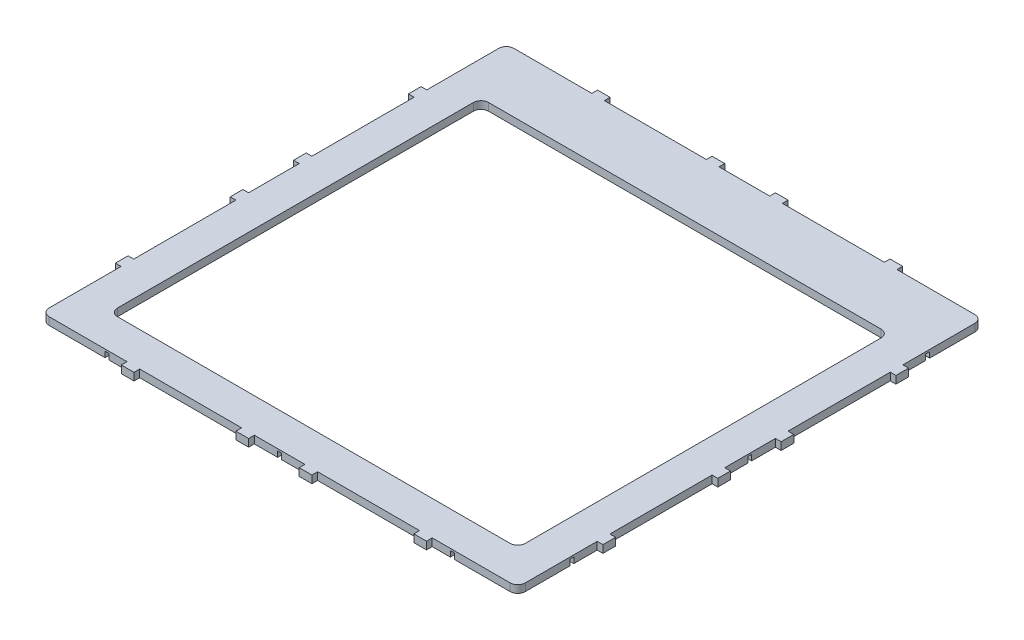
from build123d import *

# Parameters (mm, degrees)
CROQUIS1_R              = 6
SALIENTE_EXTRUIR1_DEPTH = 6
CORTAR_EXTRUIR1_DEPTH   = 4.5
CROQUIS4_W              = 19.689698303
CROQUIS4_H              = 17.939386148
CROQUIS4_W_2            = 19.444542847
SALIENTE_EXTRUIR2_DEPTH = 1.5


with BuildPart() as part:
    # Croquis1 → Saliente-Extruir1 (new body)
    with BuildSketch(Plane(origin=(0, 0, 0), x_dir=(1, 0, 0), z_dir=(0, 1, 0))):
        with BuildLine():
            Line((370, 0), (308.5, 0))
            Line((308.5, 0), (308.5, -4.5))
            Line((308.5, -4.5), (298.5, -4.5))
            Line((298.5, -4.5), (298.5, 0))
            Line((298.5, 0), (218, 0))
            Line((218, 0), (218, -4.5))
            Line((218, -4.5), (208, -4.5))
            Line((208, -4.5), (208, 0))
            Line((208, 0), (168, 0))
            Line((168, 0), (168, -4.5))
            Line((168, -4.5), (158, -4.5))
            Line((158, -4.5), (158, 0))
            Line((158, 0), (77.5, 0))
            Line((77.5, 0), (77.5, -4.5))
            Line((77.5, -4.5), (67.5, -4.5))
            Line((67.5, -4.5), (67.5, 0))
            Line((67.5, 0), (6, 0))
            ThreePointArc((6, 0), (1.757359313, 1.757359313), (0, 6))
            Line((0, 6), (0, 62.8))
            Line((0, 62.8), (-4.5, 62.8))
            Line((-4.5, 62.8), (-4.5, 72.8))
            Line((-4.5, 72.8), (0, 72.8))
            Line((0, 72.8), (0, 153.5))
            Line((0, 153.5), (-4.5, 153.5))
            Line((-4.5, 153.5), (-4.5, 163.5))
            Line((-4.5, 163.5), (0, 163.5))
            Line((0, 163.5), (0, 203.5))
            Line((0, 203.5), (-4.5, 203.5))
            Line((-4.5, 203.5), (-4.5, 213.5))
            Line((-4.5, 213.5), (0, 213.5))
            Line((0, 213.5), (0, 294.2))
            Line((0, 294.2), (-4.5, 294.2))
            Line((-4.5, 294.2), (-4.5, 304.2))
            Line((-4.5, 304.2), (0, 304.2))
            Line((0, 304.2), (0, 361))
            ThreePointArc((0, 361), (1.757359313, 365.242640687), (6, 367))
            Line((6, 367), (67.5, 367))
            Line((67.5, 367), (67.5, 371.5))
            Line((67.5, 371.5), (77.5, 371.5))
            Line((77.5, 371.5), (77.5, 367))
            Line((77.5, 367), (158, 367))
            Line((158, 367), (158, 371.5))
            Line((158, 371.5), (168, 371.5))
            Line((168, 371.5), (168, 367))
            Line((168, 367), (208, 367))
            Line((208, 367), (208, 371.5))
            Line((208, 371.5), (218, 371.5))
            Line((218, 371.5), (218, 367))
            Line((218, 367), (298.5, 367))
            Line((298.5, 367), (298.5, 371.5))
            Line((298.5, 371.5), (308.5, 371.5))
            Line((308.5, 371.5), (308.5, 367))
            Line((308.5, 367), (370, 367))
            ThreePointArc((370, 367), (374.242640687, 365.242640687), (376, 361))
            Line((376, 361), (376, 304.2))
            Line((376, 304.2), (380.5, 304.2))
            Line((380.5, 304.2), (380.5, 294.2))
            Line((380.5, 294.2), (376, 294.2))
            Line((376, 294.2), (376, 213.5))
            Line((376, 213.5), (380.5, 213.5))
            Line((380.5, 213.5), (380.5, 203.5))
            Line((380.5, 203.5), (376, 203.5))
            Line((376, 203.5), (376, 163.5))
            Line((376, 163.5), (380.5, 163.5))
            Line((380.5, 163.5), (380.5, 153.5))
            Line((380.5, 153.5), (376, 153.5))
            Line((376, 153.5), (376, 72.8))
            Line((376, 72.8), (380.5, 72.8))
            Line((380.5, 72.8), (380.5, 62.8))
            Line((380.5, 62.8), (376, 62.8))
            Line((376, 62.8), (376, 6))
            ThreePointArc((376, 6), (374.242640687, 1.757359313), (370, 0))
        make_face()
        with Locations((283, 346)):
            Circle(CROQUIS1_R, mode=Mode.SUBTRACT)
        with Locations((93, 346)):
            Circle(CROQUIS1_R, mode=Mode.SUBTRACT)
        with BuildLine():
            Line((349, 313.979406582), (349, 33))
            ThreePointArc((349, 33), (347.242640687, 28.757359313), (343, 27))
            Line((343, 27), (33, 27))
            ThreePointArc((33, 27), (28.757359313, 28.757359313), (27, 33))
            Line((27, 33), (27, 313.958112531))
            ThreePointArc((27, 313.958112531), (28.769627868, 318.230372132), (33.041887469, 320))
            Line((33.041887469, 320), (342.979406582, 320))
            ThreePointArc((342.979406582, 320), (347.236609015, 318.236609015), (349, 313.979406582))
        make_face(mode=Mode.SUBTRACT)
    extrude(amount=-SALIENTE_EXTRUIR1_DEPTH)

    # Croquis3 → Cortar-Extruir1 (cut)
    with BuildSketch(Plane.XZ.offset(6)):
        with BuildLine():
            Line((322.801879925, 0), (325.901879925, 0))
            Line((325.901879925, 0), (325.901879925, -6.500225243))
            ThreePointArc((325.901879925, -6.500225243), (326.82648456, -7.028314779), (327.192217556, -8.028320611))
            Line((327.192217556, -8.028320611), (327.192217556, -9.578320611))
            ThreePointArc((327.192217556, -9.578320611), (327.004452384, -10.317790877), (326.486648169, -10.878104031))
            Line((326.486648169, -10.878104031), (326.317403237, -10.878104031))
            ThreePointArc((326.317403237, -10.878104031), (324.351879925, -12.24449376), (322.386356613, -10.878104031))
            Line((322.386356613, -10.878104031), (322.217111681, -10.878104031))
            ThreePointArc((322.217111681, -10.878104031), (321.699307467, -10.317790877), (321.511542294, -9.578320611))
            Line((321.511542294, -9.578320611), (321.511542294, -8.028320611))
            ThreePointArc((321.511542294, -8.028320611), (321.87727529, -7.028314779), (322.801879925, -6.500225243))
            Line((322.801879925, -6.500225243), (322.801879925, 0))
        make_face()
        with BuildLine():
            Line((53.784768244, -356.121895969), (53.615523312, -356.121895969))
            ThreePointArc((53.615523312, -356.121895969), (51.65, -354.75550624), (49.684476688, -356.121895969))
            Line((49.684476688, -356.121895969), (49.515231756, -356.121895969))
            ThreePointArc((49.515231756, -356.121895969), (48.997427542, -356.682209123), (48.809662369, -357.421679389))
            Line((48.809662369, -357.421679389), (48.809662369, -358.971679389))
            ThreePointArc((48.809662369, -358.971679389), (49.175395365, -359.971685221), (50.1, -360.499774757))
            Line((50.1, -360.499774757), (50.1, -367))
            Line((50.1, -367), (53.2, -367))
            Line((53.2, -367), (53.2, -360.499774757))
            ThreePointArc((53.2, -360.499774757), (54.124604635, -359.971685221), (54.490337631, -358.971679389))
            Line((54.490337631, -358.971679389), (54.490337631, -357.421679389))
            ThreePointArc((54.490337631, -357.421679389), (54.302572458, -356.682209123), (53.784768244, -356.121895969))
        make_face()
        with BuildLine():
            Line((190.134768244, -356.121895969), (189.965523312, -356.121895969))
            ThreePointArc((189.965523312, -356.121895969), (188, -354.75550624), (186.034476688, -356.121895969))
            Line((186.034476688, -356.121895969), (185.865231756, -356.121895969))
            ThreePointArc((185.865231756, -356.121895969), (185.347427542, -356.682209123), (185.159662369, -357.421679389))
            Line((185.159662369, -357.421679389), (185.159662369, -358.971679389))
            ThreePointArc((185.159662369, -358.971679389), (185.525395365, -359.971685221), (186.45, -360.499774757))
            Line((186.45, -360.499774757), (186.45, -367))
            Line((186.45, -367), (189.55, -367))
            Line((189.55, -367), (189.55, -360.499774757))
            ThreePointArc((189.55, -360.499774757), (190.474604635, -359.971685221), (190.840337631, -358.971679389))
            Line((190.840337631, -358.971679389), (190.840337631, -357.421679389))
            ThreePointArc((190.840337631, -357.421679389), (190.652572458, -356.682209123), (190.134768244, -356.121895969))
        make_face()
        with BuildLine():
            Line((6.500225243, -44.4), (0, -44.4))
            Line((0, -44.4), (0, -41.3))
            Line((0, -41.3), (6.500225243, -41.3))
            ThreePointArc((6.500225243, -41.3), (7.028314779, -40.375395365), (8.028320611, -40.009662369))
            Line((8.028320611, -40.009662369), (9.578320611, -40.009662369))
            ThreePointArc((9.578320611, -40.009662369), (10.317790877, -40.197427542), (10.878104031, -40.715231756))
            Line((10.878104031, -40.715231756), (10.878104031, -40.884476688))
            ThreePointArc((10.878104031, -40.884476688), (12.24449376, -42.85), (10.878104031, -44.815523312))
            Line((10.878104031, -44.815523312), (10.878104031, -44.984768244))
            ThreePointArc((10.878104031, -44.984768244), (10.317790877, -45.502572458), (9.578320611, -45.690337631))
            Line((9.578320611, -45.690337631), (8.028320611, -45.690337631))
            ThreePointArc((8.028320611, -45.690337631), (7.028314779, -45.324604635), (6.500225243, -44.4))
        make_face()
        with BuildLine():
            Line((10.878104031, -185.534768244), (10.878104031, -185.365523312))
            ThreePointArc((10.878104031, -185.365523312), (12.24449376, -183.4), (10.878104031, -181.434476688))
            Line((10.878104031, -181.434476688), (10.878104031, -181.265231756))
            ThreePointArc((10.878104031, -181.265231756), (10.317790877, -180.747427542), (9.578320611, -180.559662369))
            Line((9.578320611, -180.559662369), (8.028320611, -180.559662369))
            ThreePointArc((8.028320611, -180.559662369), (7.028314779, -180.925395365), (6.500225243, -181.85))
            Line((6.500225243, -181.85), (0, -181.85))
            Line((0, -181.85), (0, -184.95))
            Line((0, -184.95), (6.500225243, -184.95))
            ThreePointArc((6.500225243, -184.95), (7.028314779, -185.874604635), (8.028320611, -186.240337631))
            Line((8.028320611, -186.240337631), (9.578320611, -186.240337631))
            ThreePointArc((9.578320611, -186.240337631), (10.317790877, -186.052572458), (10.878104031, -185.534768244))
        make_face()
        with BuildLine():
            Line((10.878104031, -321.750111483), (10.878104031, -321.919356416))
            ThreePointArc((10.878104031, -321.919356416), (12.24449376, -323.884879727), (10.878104031, -325.850403039))
            Line((10.878104031, -325.850403039), (10.878104031, -326.019647971))
            ThreePointArc((10.878104031, -326.019647971), (10.317790877, -326.537452186), (9.578320611, -326.725217358))
            Line((9.578320611, -326.725217358), (8.028320611, -326.725217358))
            ThreePointArc((8.028320611, -326.725217358), (7.028314779, -326.359484362), (6.500225243, -325.434879727))
            Line((6.500225243, -325.434879727), (0, -325.434879727))
            Line((0, -325.434879727), (0, -322.334879727))
            Line((0, -322.334879727), (6.500225243, -322.334879727))
            ThreePointArc((6.500225243, -322.334879727), (7.028314779, -321.410275093), (8.028320611, -321.044542096))
            Line((8.028320611, -321.044542096), (9.578320611, -321.044542096))
            ThreePointArc((9.578320611, -321.044542096), (10.317790877, -321.232307269), (10.878104031, -321.750111483))
        make_face()
        with BuildLine():
            Line((369.499774757, -322.15), (376, -322.15))
            Line((376, -322.15), (376, -325.25))
            Line((376, -325.25), (369.499774757, -325.25))
            ThreePointArc((369.499774757, -325.25), (368.971685221, -326.174604635), (367.971679389, -326.540337631))
            Line((367.971679389, -326.540337631), (366.421679389, -326.540337631))
            ThreePointArc((366.421679389, -326.540337631), (365.682209123, -326.352572458), (365.121895969, -325.834768244))
            Line((365.121895969, -325.834768244), (365.121895969, -325.665523312))
            ThreePointArc((365.121895969, -325.665523312), (363.75550624, -323.7), (365.121895969, -321.734476688))
            Line((365.121895969, -321.734476688), (365.121895969, -321.565231756))
            ThreePointArc((365.121895969, -321.565231756), (365.682209123, -321.047427542), (366.421679389, -320.859662369))
            Line((366.421679389, -320.859662369), (367.971679389, -320.859662369))
            ThreePointArc((367.971679389, -320.859662369), (368.971685221, -321.225395365), (369.499774757, -322.15))
        make_face()
        with BuildLine():
            Line((367.971679389, -180.373855212), (366.421679389, -180.373855212))
            ThreePointArc((366.421679389, -180.373855212), (365.682209123, -180.561620384), (365.121895969, -181.079424598))
            Line((365.121895969, -181.079424598), (365.121895969, -181.248669531))
            ThreePointArc((365.121895969, -181.248669531), (363.75550624, -183.214192843), (365.121895969, -185.179716154))
            Line((365.121895969, -185.179716154), (365.121895969, -185.348961087))
            ThreePointArc((365.121895969, -185.348961087), (365.682209123, -185.866765301), (366.421679389, -186.054530474))
            Line((366.421679389, -186.054530474), (367.971679389, -186.054530474))
            ThreePointArc((367.971679389, -186.054530474), (368.971685221, -185.688797477), (369.499774757, -184.764192843))
            Line((369.499774757, -184.764192843), (376, -184.764192843))
            Line((376, -184.764192843), (376, -181.664192843))
            Line((376, -181.664192843), (369.499774757, -181.664192843))
            ThreePointArc((369.499774757, -181.664192843), (368.971685221, -180.739588208), (367.971679389, -180.373855212))
        make_face()
        with BuildLine():
            Line((365.121895969, -44.862745577), (365.121895969, -44.693500644))
            ThreePointArc((365.121895969, -44.693500644), (363.75550624, -42.727977333), (365.121895969, -40.762454021))
            Line((365.121895969, -40.762454021), (365.121895969, -40.593209088))
            ThreePointArc((365.121895969, -40.593209088), (365.682209123, -40.075404874), (366.421679389, -39.887639702))
            Line((366.421679389, -39.887639702), (367.971679389, -39.887639702))
            ThreePointArc((367.971679389, -39.887639702), (368.971685221, -40.253372698), (369.499774757, -41.177977333))
            Line((369.499774757, -41.177977333), (376, -41.177977333))
            Line((376, -41.177977333), (376, -44.277977333))
            Line((376, -44.277977333), (369.499774757, -44.277977333))
            ThreePointArc((369.499774757, -44.277977333), (368.971685221, -45.202581967), (367.971679389, -45.568314963))
            Line((367.971679389, -45.568314963), (366.421679389, -45.568314963))
            ThreePointArc((366.421679389, -45.568314963), (365.682209123, -45.380549791), (365.121895969, -44.862745577))
        make_face()
        with BuildLine():
            Line((50.1, 0), (53.2, 0))
            Line((53.2, 0), (53.2, -6.500225243))
            ThreePointArc((53.2, -6.500225243), (54.124604635, -7.028314779), (54.490337631, -8.028320611))
            Line((54.490337631, -8.028320611), (54.490337631, -9.578320611))
            ThreePointArc((54.490337631, -9.578320611), (54.302572458, -10.317790877), (53.784768244, -10.878104031))
            Line((53.784768244, -10.878104031), (53.615523312, -10.878104031))
            ThreePointArc((53.615523312, -10.878104031), (51.65, -12.24449376), (49.684476688, -10.878104031))
            Line((49.684476688, -10.878104031), (49.515231756, -10.878104031))
            ThreePointArc((49.515231756, -10.878104031), (48.997427542, -10.317790877), (48.809662369, -9.578320611))
            Line((48.809662369, -9.578320611), (48.809662369, -8.028320611))
            ThreePointArc((48.809662369, -8.028320611), (49.175395365, -7.028314779), (50.1, -6.500225243))
            Line((50.1, -6.500225243), (50.1, 0))
        make_face()
        with BuildLine():
            Line((326.486648169, -356.121895969), (326.317403237, -356.121895969))
            ThreePointArc((326.317403237, -356.121895969), (324.351879925, -354.75550624), (322.386356613, -356.121895969))
            Line((322.386356613, -356.121895969), (322.217111681, -356.121895969))
            ThreePointArc((322.217111681, -356.121895969), (321.699307467, -356.682209123), (321.511542294, -357.421679389))
            Line((321.511542294, -357.421679389), (321.511542294, -358.971679389))
            ThreePointArc((321.511542294, -358.971679389), (321.87727529, -359.971685221), (322.801879925, -360.499774757))
            Line((322.801879925, -360.499774757), (322.801879925, -367))
            Line((322.801879925, -367), (325.901879925, -367))
            Line((325.901879925, -367), (325.901879925, -360.499774757))
            ThreePointArc((325.901879925, -360.499774757), (326.82648456, -359.971685221), (327.192217556, -358.971679389))
            Line((327.192217556, -358.971679389), (327.192217556, -357.421679389))
            ThreePointArc((327.192217556, -357.421679389), (327.004452384, -356.682209123), (326.486648169, -356.121895969))
        make_face()
        with BuildLine():
            Line((186.45, 0), (189.55, 0))
            Line((189.55, 0), (189.55, -6.500225243))
            ThreePointArc((189.55, -6.500225243), (190.474604635, -7.028314779), (190.840337631, -8.028320611))
            Line((190.840337631, -8.028320611), (190.840337631, -9.578320611))
            ThreePointArc((190.840337631, -9.578320611), (190.652572458, -10.317790877), (190.134768244, -10.878104031))
            Line((190.134768244, -10.878104031), (189.965523312, -10.878104031))
            ThreePointArc((189.965523312, -10.878104031), (188, -12.24449376), (186.034476688, -10.878104031))
            Line((186.034476688, -10.878104031), (185.865231756, -10.878104031))
            ThreePointArc((185.865231756, -10.878104031), (185.347427542, -10.317790877), (185.159662369, -9.578320611))
            Line((185.159662369, -9.578320611), (185.159662369, -8.028320611))
            ThreePointArc((185.159662369, -8.028320611), (185.525395365, -7.028314779), (186.45, -6.500225243))
            Line((186.45, -6.500225243), (186.45, 0))
        make_face()
    extrude(amount=-CORTAR_EXTRUIR1_DEPTH, mode=Mode.SUBTRACT)

    # Croquis4 → Saliente-Extruir2 (add)
    with BuildSketch(Plane(origin=(0, 0, 0), x_dir=(1, 0, 0), z_dir=(0, 1, 0))):
        with Locations((92.462989416, 345.619306962)):
            Rectangle(CROQUIS4_W, CROQUIS4_H)
        with Locations((282.063135879, 345.619306962)):
            Rectangle(CROQUIS4_W_2, CROQUIS4_H)
    extrude(amount=-SALIENTE_EXTRUIR2_DEPTH)


solid = part.part
